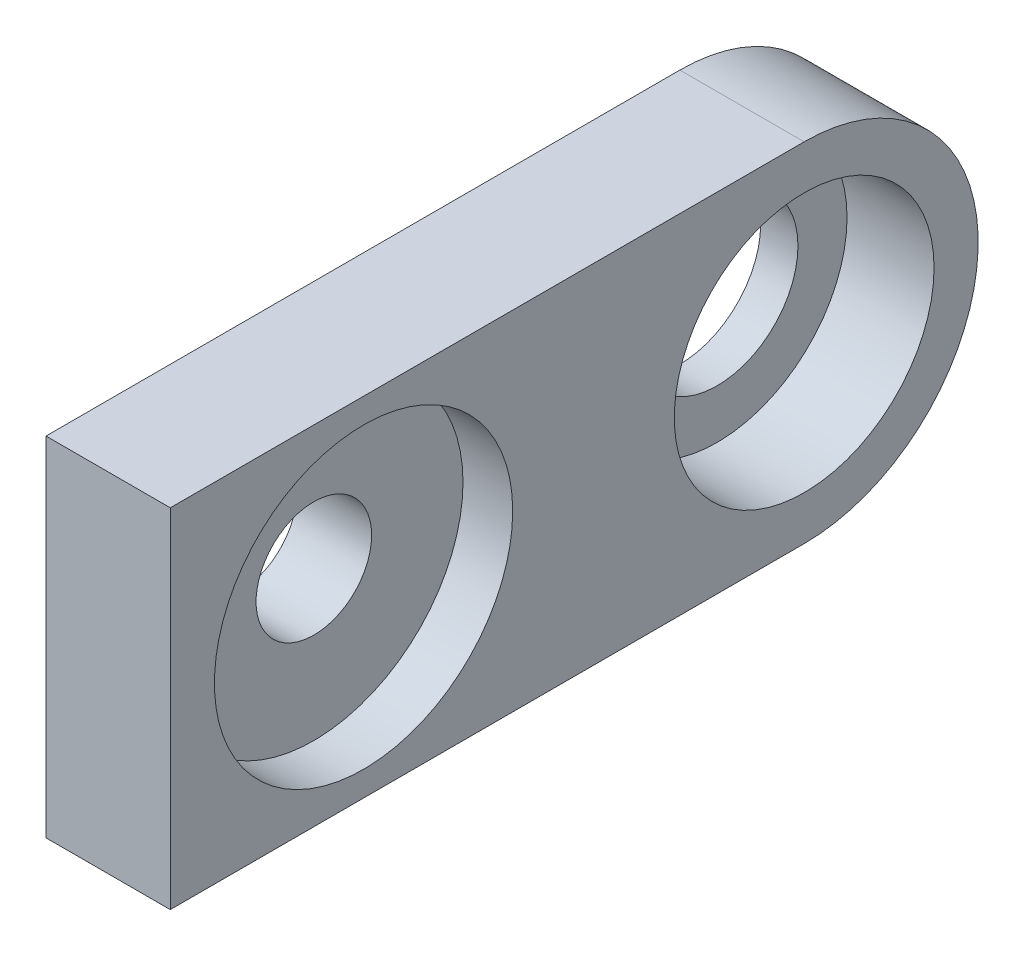
from build123d import *

# Parameters (mm, degrees)
BOSS_EXTRUDE1_DEPTH = 10
SKETCH2_R           = 10.45
CUT_EXTRUDE1_DEPTH  = 7
SKETCH3_R           = 6.5
CUT_EXTRUDE2_DEPTH  = 54.347914673
SKETCH4_R           = 12
CUT_EXTRUDE3_DEPTH  = 4
SKETCH5_R           = 4.65
CUT_EXTRUDE4_DEPTH  = 54.225933529


with BuildPart() as part:
    # Sketch1 → Boss-Extrude1 (new body)
    with BuildSketch(Plane.YZ):
        with BuildLine():
            Line((-14, 0), (-14, 51))
            Line((-14, 51), (14, 51))
            Line((14, 51), (14, 0))
            ThreePointArc((14, 0), (0, -14), (-14, 0))
        make_face()
    extrude(amount=BOSS_EXTRUDE1_DEPTH)

    # Sketch2 → Cut-Extrude1 (cut)
    with BuildSketch(Plane.YZ.offset(10)):
        Circle(SKETCH2_R)
    extrude(amount=-CUT_EXTRUDE1_DEPTH, mode=Mode.SUBTRACT)

    # Sketch3 → Cut-Extrude2 (cut, through all)
    with BuildSketch(Plane.YZ.offset(3)):
        Circle(SKETCH3_R)
    extrude(amount=-CUT_EXTRUDE2_DEPTH, mode=Mode.SUBTRACT)

    # Sketch4 → Cut-Extrude3 (cut)
    with BuildSketch(Plane.YZ.offset(10)):
        with Locations((0, 35.45)):
            Circle(SKETCH4_R)
    extrude(amount=-CUT_EXTRUDE3_DEPTH, mode=Mode.SUBTRACT)

    # Sketch5 → Cut-Extrude4 (cut, through all)
    with BuildSketch(Plane.YZ.offset(6)):
        with Locations((0, 35.45)):
            Circle(SKETCH5_R)
    extrude(amount=-CUT_EXTRUDE4_DEPTH, mode=Mode.SUBTRACT)


solid = part.part
